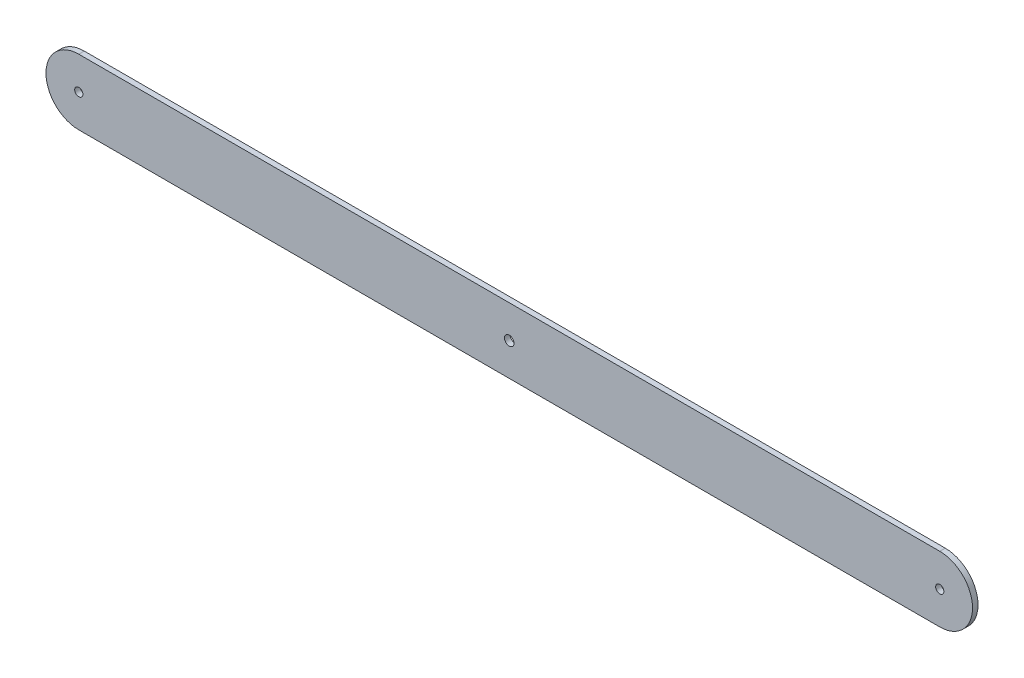
from build123d import *

# Parameters (mm, degrees)
SKETCH1_R           = 1.5
SKETCH1_R_2         = 1.75
BOSS_EXTRUDE1_DEPTH = 2


with BuildPart() as part:
    # Sketch1 → Boss-Extrude1 (new body)
    with BuildSketch(Plane.XY):
        with BuildLine():
            Line((-157.6, 12), (157.6, 12))
            ThreePointArc((157.6, 12), (169.6, 0), (157.6, -12))
            Line((157.6, -12), (-157.6, -12))
            ThreePointArc((-157.6, -12), (-169.6, 0), (-157.6, 12))
        make_face()
        with Locations((-157.6, 0)):
            Circle(SKETCH1_R, mode=Mode.SUBTRACT)
        Circle(SKETCH1_R_2, mode=Mode.SUBTRACT)
        with Locations((157.6, 0)):
            Circle(SKETCH1_R, mode=Mode.SUBTRACT)
    extrude(amount=BOSS_EXTRUDE1_DEPTH)


solid = part.part
